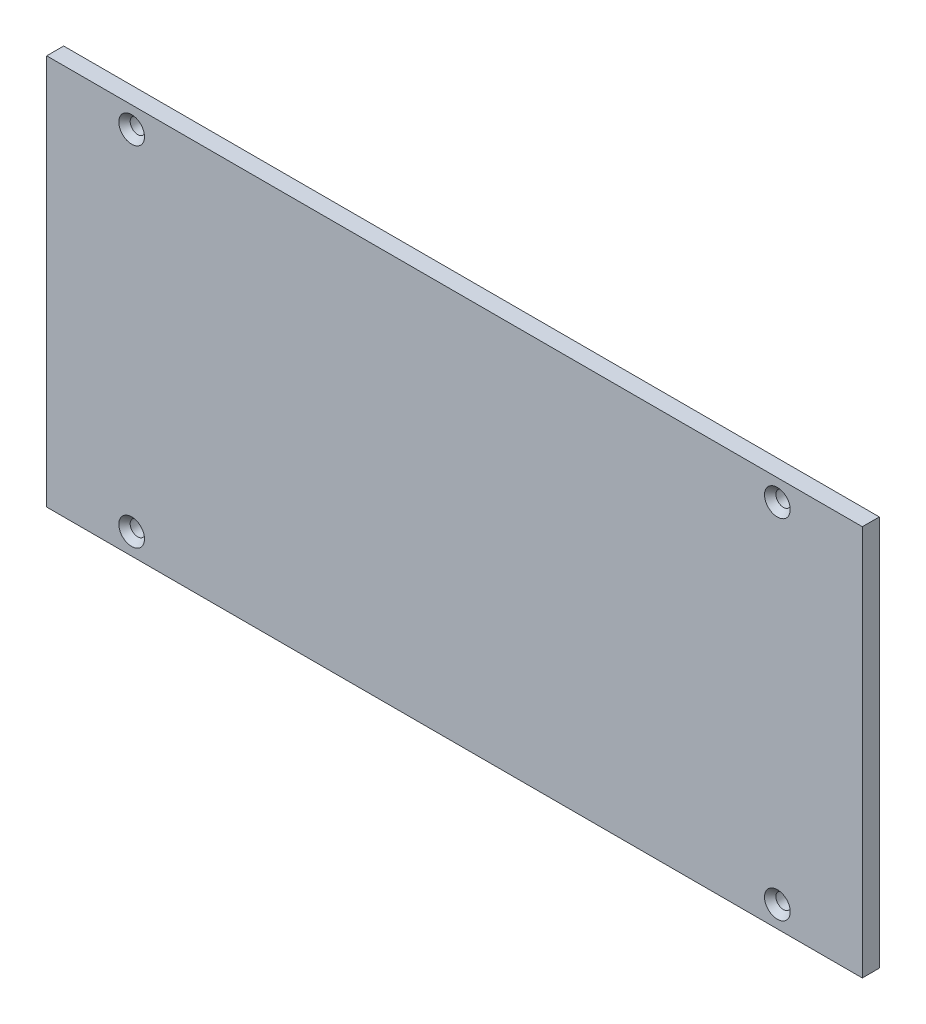
from build123d import *

# Parameters (mm, degrees)
SKETCH1_W                                      = 96
SKETCH1_H                                      = 46
BOSS_EXTRUDE1_DEPTH                            = 2
CSK_FOR_0_FLAT_HEAD_MACHINE_SCREW1_D           = 1.778
CSK_FOR_0_FLAT_HEAD_MACHINE_SCREW1_CSINK_D     = 3.0226
CSK_FOR_0_FLAT_HEAD_MACHINE_SCREW1_CSINK_ANGLE = 82


with BuildPart() as part:
    # Sketch1 → Boss-Extrude1 (new body)
    with BuildSketch(Plane.XY):
        with Locations((48, 23)):
            Rectangle(SKETCH1_W, SKETCH1_H)
    extrude(amount=BOSS_EXTRUDE1_DEPTH)

    # CSK for #0 Flat Head Machine Screw1 (through all)
    with Locations(Plane.XY.offset(2)):
        with Locations((10, 43.5), (10, 2.5), (86, 2.5), (86, 43.5)):
            CounterSinkHole(CSK_FOR_0_FLAT_HEAD_MACHINE_SCREW1_D / 2, CSK_FOR_0_FLAT_HEAD_MACHINE_SCREW1_CSINK_D / 2, counter_sink_angle=CSK_FOR_0_FLAT_HEAD_MACHINE_SCREW1_CSINK_ANGLE)


solid = part.part
